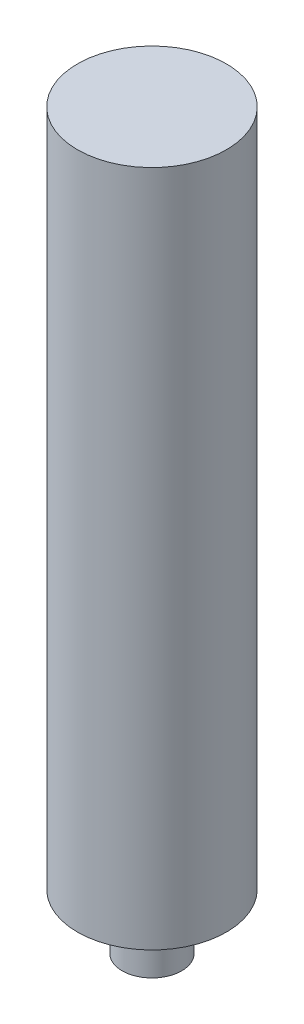
from build123d import *

# Parameters (mm, degrees)
SKETCH1_R           = 40
BOSS_EXTRUDE1_DEPTH = 364
SKETCH2_R           = 16
BOSS_EXTRUDE2_DEPTH = 30


with BuildPart() as part:
    # Sketch1 → Boss-Extrude1 (new body)
    with BuildSketch(Plane(origin=(0, 0, 0), x_dir=(1, 0, 0), z_dir=(0, 1, 0))):
        Circle(SKETCH1_R)
    extrude(amount=BOSS_EXTRUDE1_DEPTH)

    # Sketch2 → Boss-Extrude2 (add)
    with BuildSketch(Plane.XZ):
        Circle(SKETCH2_R)
    extrude(amount=BOSS_EXTRUDE2_DEPTH)


solid = part.part
